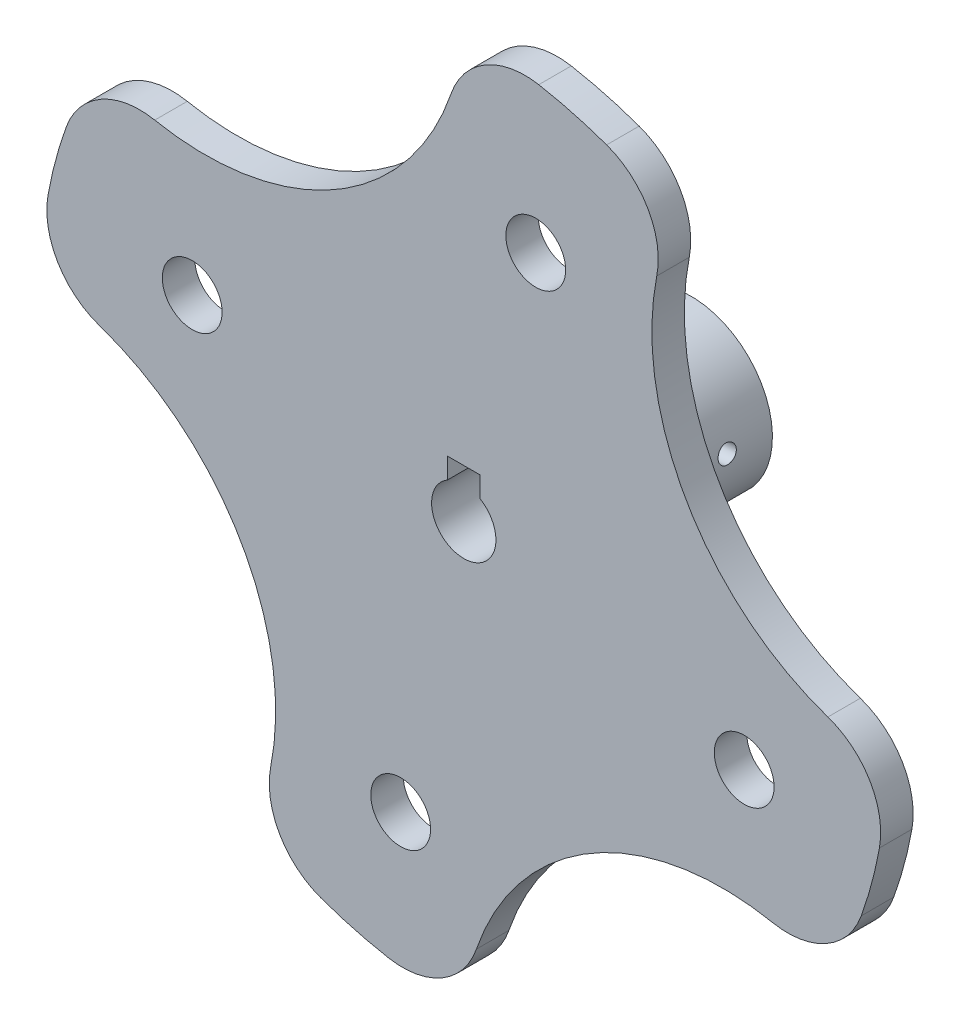
from build123d import *

# Parameters (mm, degrees)
SKETCH1_R                           = 65
BOSS_EXTRUDE1_DEPTH                 = 5
CUT_EXTRUDE2_START                  = -25
CUT_EXTRUDE2_DEPTH                  = 25
FILLET2_R                           = 12
SKETCH9_R                           = 12.5
BOSS_EXTRUDE4_DEPTH                 = 30
SKETCH10_R                          = 4.95
CUT_EXTRUDE3_DEPTH                  = 98.249387408
SKETCH11_W                          = 5
SKETCH11_H                          = 5
CUT_EXTRUDE4_DEPTH                  = 98.249387408
F_1_0MM_DOWEL_HOLE3_D               = 2.8
F_1_0MM_DOWEL_HOLE3_DEPTH           = 33.158795133
F_1_0MM_DOWEL_HOLE3_TIP             = 0.841204867
F_1_0MM_DOWEL_HOLE3_ON_FACE_2_D     = 2.8
F_1_0MM_DOWEL_HOLE3_ON_FACE_2_DEPTH = 33.158795133
F_1_0MM_DOWEL_HOLE3_ON_FACE_2_TIP   = 0.841204867
BOSS_EXTRUDE5_DEPTH                 = 4
BOSS_EXTRUDE5_DEPTH_BACK            = 5
SKETCH13_R                          = 33
F_1_0MM_DOWEL_HOLE4_D               = 9.2
F_1_0MM_DOWEL_HOLE4_DEPTH           = 31.236041152
F_1_0MM_DOWEL_HOLE4_TIP             = 2.763958848
FILLET4_R                           = 15
CUT_EXTRUDE5_DEPTH                  = 98.249387408


with BuildPart() as part:
    # Sketch1 → Boss-Extrude1 (new body)
    with BuildSketch(Plane.XY):
        Circle(SKETCH1_R)
    extrude(amount=BOSS_EXTRUDE1_DEPTH)

    # Sketch6 → Cut-Extrude2 (cut)
    with BuildSketch(Plane.XY.offset(5).offset(CUT_EXTRUDE2_START)):
        with BuildLine():
            ThreePointArc((-65, 0), (-56.291651246, -32.5), (-32.5, -56.291651246))
            ThreePointArc((-32.5, -56.291651246), (-34.303351875, -19.805049439), (-65, 0))
        make_face()
        with BuildLine():
            ThreePointArc((56.291651246, -32.5), (19.805049439, -34.303351875), (0, -65))
            ThreePointArc((0, -65), (32.5, -56.291651246), (56.291651246, -32.5))
        make_face()
        with BuildLine():
            ThreePointArc((0, 65), (-32.5, 56.291651246), (-56.291651246, 32.5))
            ThreePointArc((-56.291651246, 32.5), (-19.805049439, 34.303351875), (0, 65))
        make_face()
        with BuildLine():
            ThreePointArc((32.5, 56.291651246), (34.303351875, 19.805049439), (65, 0))
            ThreePointArc((65, 0), (56.291651246, 32.5), (32.5, 56.291651246))
        make_face()
    extrude(amount=CUT_EXTRUDE2_DEPTH, mode=Mode.SUBTRACT)

    # Fillet2
    fillet2_edges = [part.edges().sort_by_distance(p)[0] for p in [
        (-56.291651246, 32.5, 2.5),
        (0, 65, 2.5),
        (32.5, 56.291651246, 2.5),
        (65, 0, 2.5),
        (-32.5, -56.291651246, 2.5),
        (-65, 0, 2.5),
        (56.291651246, -32.5, 2.5),
        (0, -65, 2.5),
    ]]
    fillet(fillet2_edges, radius=FILLET2_R)

    # Sketch9 → Boss-Extrude4 (add)
    with BuildSketch(Plane(origin=(0, 0, 0), x_dir=(-1, 0, 0), z_dir=(0, 0, -1))):
        Circle(SKETCH9_R)
    extrude(amount=BOSS_EXTRUDE4_DEPTH)

    # Sketch10 → Cut-Extrude3 (cut, through all)
    with BuildSketch(Plane(origin=(0, 0, -30), x_dir=(-1, 0, 0), z_dir=(0, 0, -1))):
        Circle(SKETCH10_R)
    extrude(amount=-CUT_EXTRUDE3_DEPTH, mode=Mode.SUBTRACT)

    # Sketch11 → Cut-Extrude4 (cut, through all)
    with BuildSketch(Plane(origin=(0, 0, -30), x_dir=(-1, 0, 0), z_dir=(0, 0, -1))):
        with Locations((0, 4.95)):
            Rectangle(SKETCH11_W, SKETCH11_H)
    extrude(amount=-CUT_EXTRUDE4_DEPTH, mode=Mode.SUBTRACT)

    # Ø1.0mm Dowel Hole3
    with Locations(Plane(origin=(0, -12.5, -18.578187756), x_dir=(-1, 0, 0), z_dir=(0, -1, 0))):
        with Locations((0, 0)):
            Hole(F_1_0MM_DOWEL_HOLE3_D / 2, depth=F_1_0MM_DOWEL_HOLE3_DEPTH)
            with Locations((0, 0, -(F_1_0MM_DOWEL_HOLE3_DEPTH + F_1_0MM_DOWEL_HOLE3_TIP / 2))):  # 118° drill point
                Cone(0, F_1_0MM_DOWEL_HOLE3_D / 2, F_1_0MM_DOWEL_HOLE3_TIP, mode=Mode.SUBTRACT)

    # Ø1.0mm Dowel Hole3 on face 2
    with Locations(Plane(origin=(12.447431605, 1.14518402, -23.093887112), x_dir=(-0.091614954639, 0.995794506957, 0), z_dir=(0.995794506957, 0.091614954639, 0))):
        with Locations((0, 0)):
            Hole(F_1_0MM_DOWEL_HOLE3_ON_FACE_2_D / 2, depth=F_1_0MM_DOWEL_HOLE3_ON_FACE_2_DEPTH)
            with Locations((0, 0, -(F_1_0MM_DOWEL_HOLE3_ON_FACE_2_DEPTH + F_1_0MM_DOWEL_HOLE3_ON_FACE_2_TIP / 2))):  # 118° drill point
                Cone(0, F_1_0MM_DOWEL_HOLE3_ON_FACE_2_D / 2, F_1_0MM_DOWEL_HOLE3_ON_FACE_2_TIP, mode=Mode.SUBTRACT)

    # Sketch13 → Boss-Extrude5 (add, two sides: drawn at the far end of the back side and taken through both)
    with BuildSketch(Plane(origin=(0, 0, 0), x_dir=(-1, 0, 0), z_dir=(0, 0, -1)).offset(-BOSS_EXTRUDE5_DEPTH_BACK)):
        Circle(SKETCH13_R)
    extrude(amount=BOSS_EXTRUDE5_DEPTH + BOSS_EXTRUDE5_DEPTH_BACK)

    # Ø1.0mm Dowel Hole4
    with Locations(Plane(origin=(11.07745513, 41.341625365, 0), x_dir=(-1, 0, 0), z_dir=(0, 0, -1))):
        with Locations((0, 0), (20.784914346, -84.940934124), (52.862924235, -32.078009888), (-32.078009889, -52.862924235)):
            Hole(F_1_0MM_DOWEL_HOLE4_D / 2, depth=F_1_0MM_DOWEL_HOLE4_DEPTH)
            with Locations((0, 0, -(F_1_0MM_DOWEL_HOLE4_DEPTH + F_1_0MM_DOWEL_HOLE4_TIP / 2))):  # 118° drill point
                Cone(0, F_1_0MM_DOWEL_HOLE4_D / 2, F_1_0MM_DOWEL_HOLE4_TIP, mode=Mode.SUBTRACT)

    # Fillet4
    # the kernel refuses this fillet: 15 mm, written as the material it adds along each edge
    with BuildSketch(Plane(origin=(0, 0, -4), x_dir=(-1, 0, 0), z_dir=(0, 1, 0))) as fillet4_piece_1_section:
        with BuildLine():
            CenterArc((12.5 + FILLET4_R, -FILLET4_R), FILLET4_R, 90, 90)
            Line((12.5, -FILLET4_R), (12.5, 0))
            Line((12.5, 0), (12.5 + FILLET4_R, 0))
        make_face()
    fillet4_piece_1 = revolve(axis=Axis((0, 0, -4), (0, 0, 1)), mode=Mode.PRIVATE)
    fillet4_piece_1 = fillet4_piece_1 - Plane(origin=(0, 0, -18.578187756), x_dir=(1, 0, 0), z_dir=(0, 1, 0)) * Cylinder(1.4, 110, mode=Mode.PRIVATE)
    add(fillet4_piece_1)

    # Sketch17 → Cut-Extrude5 (cut, through all)
    with BuildSketch(Plane(origin=(0, 0, -30), x_dir=(-1, 0, 0), z_dir=(0, 0, -1))):
        with BuildLine():
            Line((2.5, 4.272294466), (2.5, 7.45))
            Line((2.5, 7.45), (-2.5, 7.45))
            Line((-2.5, 7.45), (-2.5, 4.272294466))
            ThreePointArc((-2.5, 4.272294466), (0, -4.95), (2.5, 4.272294466))
        make_face()
    extrude(amount=-CUT_EXTRUDE5_DEPTH, mode=Mode.SUBTRACT)


solid = part.part
